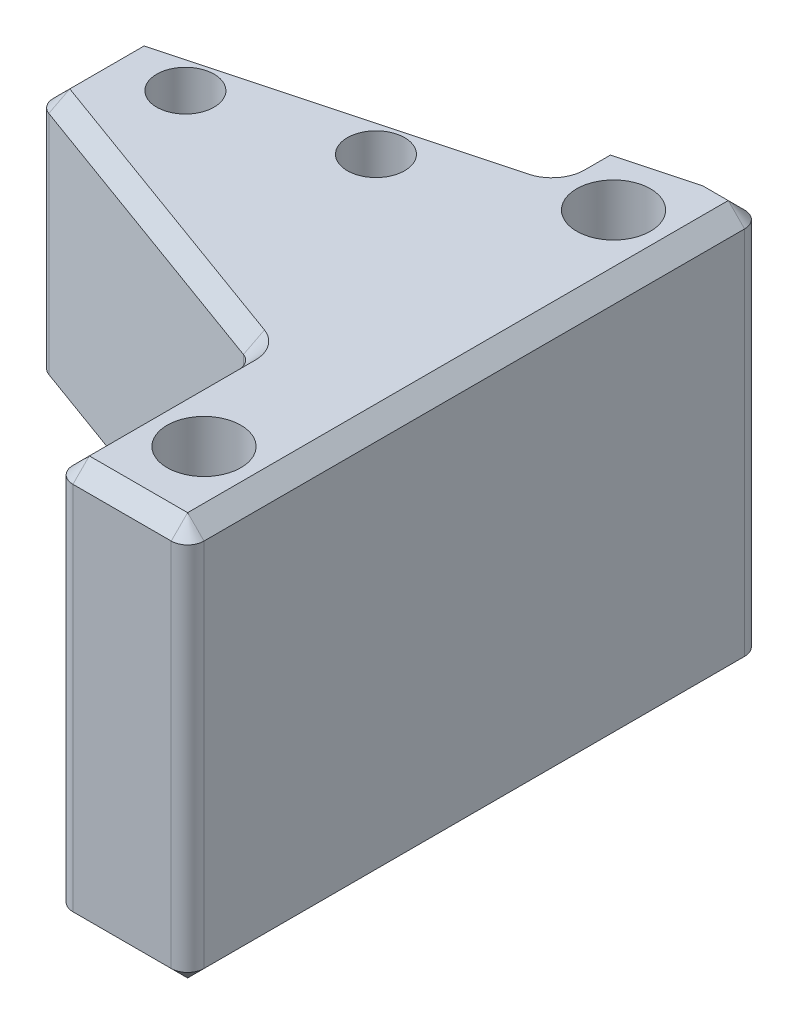
from build123d import *
from build123d.topology import SkipClean

# Parameters (mm, degrees)
SKETCH1_W              = 8
SKETCH1_H              = 35
SKETCH1_R              = 2.25
BOSS_EXTRUDE1_DEPTH    = 10
SKETCH2_R              = 1.75
BOSS_EXTRUDE2_DEPTH    = 10
CUT_EXTRUDE1_DEPTH     = 10
SKETCH3_R              = 2.25
BOSS_EXTRUDE3_DEPTH    = 6
BOSS_EXTRUDE5_START    = 9
SKETCH5_R              = 2.25
BOSS_EXTRUDE5_DEPTH    = 9
CUT_EXTRUDE2_START     = -8
CUT_EXTRUDE2_OUTLINE_W = 35
CUT_EXTRUDE2_OUTLINE_H = 0.2
CUT_EXTRUDE2_DEPTH     = 8
BOSS_EXTRUDE6_START    = 5.8
SKETCH8_R              = 1.75
BOSS_EXTRUDE6_DEPTH    = 5.8
SKETCH9_W              = 5.7
SKETCH9_H              = 2.8
CUT_EXTRUDE3_DEPTH     = 7
FILLET1_R              = 1
FILLET2_R              = 1
CHAMFER1_SIZE          = 1
CHAMFER2_SIZE          = 1


# Read off the part's stored shape, not the designer's step: Cut-Extrude2
# Some blends are built 0.0001 mm under size
with BuildPart() as part:
    # Sketch1 → Boss-Extrude1 (new body)
    with BuildSketch(Plane(origin=(0, 0, 0), x_dir=(1, 0, 0), z_dir=(0, 1, 0))):
        Rectangle(SKETCH1_W, SKETCH1_H)
        with Locations(Location((0, 12.5, 0), (0, 0, 270))):
            Circle(SKETCH1_R, mode=Mode.SUBTRACT)
        with Locations(Location((0, -12.5, 0), (0, 0, 270))):
            Circle(SKETCH1_R, mode=Mode.SUBTRACT)
    extrude(amount=BOSS_EXTRUDE1_DEPTH)

    # Sketch2 → Boss-Extrude2 (add, through all)
    with BuildSketch(Plane(origin=(0, 10, 0), x_dir=(1, 0, 0), z_dir=(0, 1, 0))):
        Polygon((-24, 1.60698438), (-4, -5.672420305), (-4, 12.965968228), (-24, 7.60698438), align=None)
        with Locations(Location((-19.37629535, 5.740073766, 0), (0, 0, 270))):
            Circle(SKETCH2_R, mode=Mode.SUBTRACT)
        with Locations(Location((-10.2, 8.198854694, 0), (0, 0, 270))):
            Circle(SKETCH2_R, mode=Mode.SUBTRACT)
    extrude(amount=-BOSS_EXTRUDE2_DEPTH)

    # Sketch2<3> → Cut-Extrude1 (cut)
    with BuildSketch(Plane(origin=(0, 10, 0), x_dir=(1, 0, 0), z_dir=(0, 1, 0))):
        Polygon((-4, 17.5), (-4, 16.07179677), (1.330127019, 17.5), align=None)
    extrude(amount=-CUT_EXTRUDE1_DEPTH, mode=Mode.SUBTRACT)

    # Sketch3 → Boss-Extrude3 (add)
    with BuildSketch(Plane(origin=(0, 10, 0), x_dir=(1, 0, 0), z_dir=(0, 1, 0))):
        Polygon((-4, 16.07179677), (-4, -17.5), (4, -17.5), (4, 17.5), (1.330127019, 17.5), align=None)
        with Locations(Location((0, -12.5, 0), (0, 0, 270))):
            Circle(SKETCH3_R, mode=Mode.SUBTRACT)
        with Locations(Location((0, 12.5, 0), (0, 0, 270))):
            Circle(SKETCH3_R, mode=Mode.SUBTRACT)
    extrude(amount=BOSS_EXTRUDE3_DEPTH)

    # Sketch5 → Boss-Extrude5 (add)
    with SkipClean():  # the faces are left unmerged after this step: merging them gives an invalid solid
        with BuildSketch(Plane.XZ.offset(BOSS_EXTRUDE5_START)):
            Polygon((-4, 17.5), (-4, -16.07179677), (1.330127019, -17.5), (4, -17.5), (4, 17.5), align=None)
            with Locations(Location((0, -12.5, 0), (0, 0, 270))):
                Circle(SKETCH5_R, mode=Mode.SUBTRACT)
            with Locations(Location((0, 12.5, 0), (0, 0, 270))):
                Circle(SKETCH5_R, mode=Mode.SUBTRACT)
        extrude(amount=-BOSS_EXTRUDE5_DEPTH)

    # Cut-Extrude2 outline → Cut-Extrude2 (cut)
    with SkipClean():  # the faces are left unmerged after this step: merging them gives an invalid solid
        with BuildSketch(Plane(origin=(4, 0, 0), x_dir=(0, 0, -1), z_dir=(1, 0, 0)).offset(CUT_EXTRUDE2_START)):
            with Locations((0, 15.9)):
                Rectangle(CUT_EXTRUDE2_OUTLINE_W, CUT_EXTRUDE2_OUTLINE_H)
            with Locations((0, -8.9)):
                Rectangle(CUT_EXTRUDE2_OUTLINE_W, CUT_EXTRUDE2_OUTLINE_H)
        extrude(amount=CUT_EXTRUDE2_DEPTH, mode=Mode.SUBTRACT)

    # Sketch8 → Boss-Extrude6 (add)
    with SkipClean():  # the faces are left unmerged after this step: merging them gives an invalid solid
        with BuildSketch(Plane(origin=(0, 10, 0), x_dir=(1, 0, 0), z_dir=(0, 1, 0)).offset(BOSS_EXTRUDE6_START)):
            Polygon((-4, -5.672420305), (-4, 12.965968228), (-24, 7.60698438), (-24, 1.60698438), align=None)
            with Locations(Location((-10.2, 8.198854694, 0), (0, 0, 270))):
                Circle(SKETCH8_R, mode=Mode.SUBTRACT)
            with Locations(Location((-19.37629535, 5.740073766, 0), (0, 0, 270))):
                Circle(SKETCH8_R, mode=Mode.SUBTRACT)
        extrude(amount=-BOSS_EXTRUDE6_DEPTH)

    # Sketch9 → Cut-Extrude3 (cut)
    with SkipClean():  # the faces are left unmerged after this step: merging them gives an invalid solid
        with BuildSketch(Plane(origin=(-3.50944125, 0, -13.09741305), x_dir=(-0.9659258262890672, 0, 0.25881904510252496), z_dir=(-0.25881904510252496, 0, -0.9659258262890672))):
            with Locations((7.730423685, 6.4)):
                Rectangle(SKETCH9_W, SKETCH9_H)
            with Locations((17.230423685, 6.4)):
                Rectangle(SKETCH9_W, SKETCH9_H)
        extrude(amount=-CUT_EXTRUDE3_DEPTH, mode=Mode.SUBTRACT)

    # Fillet1
    # the kernel refuses this fillet: 1 mm, written as the material it adds along each edge
    with BuildSketch(Plane(origin=(-4, 10, -12.965968228), x_dir=(0, 0, -1), z_dir=(0, -1, 0))) as fillet1_piece_1:
        with BuildLine():
            CenterArc((FILLET1_R * 0.767326987979, -FILLET1_R), FILLET1_R, 90, 75)
            Line((-FILLET1_R * 0.19859883831, -FILLET1_R * 0.741180954897), (0, 0))
            Line((0, 0), (FILLET1_R * 0.767326987979, 0))
        make_face()
    extrude(amount=10)
    with BuildSketch(Plane(origin=(-4, 10, 5.672420305), x_dir=(0, 0, 1), z_dir=(0, -1, 0))) as fillet1_piece_2:
        with BuildLine():
            CenterArc((FILLET1_R * 0.70020753821, FILLET1_R), FILLET1_R, 200, 70)
            Line((-FILLET1_R * 0.239485082576, FILLET1_R * 0.657979856674), (0, 0))
            Line((0, 0), (FILLET1_R * 0.70020753821, 0))
        make_face()
    extrude(amount=10)
    with BuildSketch(Plane(origin=(-4, 15.8, 5.672420305), x_dir=(0, 0, 1), z_dir=(0, -1, 0))) as fillet1_piece_3:
        with BuildLine():
            CenterArc((FILLET1_R * 0.70020753821, FILLET1_R), FILLET1_R, 200, 70)
            Line((-FILLET1_R * 0.239485082576, FILLET1_R * 0.657979856674), (0, 0))
            Line((0, 0), (FILLET1_R * 0.70020753821, 0))
        make_face()
    extrude(amount=5.8)
    with BuildSketch(Plane(origin=(-4, 15.8, -12.965968228), x_dir=(0, 0, -1), z_dir=(0, -1, 0))) as fillet1_piece_4:
        with BuildLine():
            CenterArc((FILLET1_R * 0.767326987979, -FILLET1_R), FILLET1_R, 90, 75)
            Line((-FILLET1_R * 0.19859883831, -FILLET1_R * 0.741180954897), (0, 0))
            Line((0, 0), (FILLET1_R * 0.767326987979, 0))
        make_face()
    extrude(amount=5.8)
    # the kernel refuses this fillet: 1 mm, written as the material it takes off along each edge
    with BuildSketch(Plane(origin=(4, 0, -17.5), x_dir=(0, 0, 1), z_dir=(0, 1, 0)), Plane(origin=(4, 0, 17.5), x_dir=(-1, 0, 0), z_dir=(0, 1, 0)), Plane(origin=(-4, 18.3, 17.5), x_dir=(1, 0, 0), z_dir=(0, -1, 0))) as fillet1_2_piece_1:
        with BuildLine():
            CenterArc((FILLET1_R, -FILLET1_R), FILLET1_R, 90, 90)
            Line((0, -FILLET1_R), (0, 0))
            Line((0, 0), (FILLET1_R, 0))
        make_face()
    extrude(amount=18.3, mode=Mode.SUBTRACT)
    with BuildSketch(Plane(origin=(-8.22356853, 5, -11.834266452), x_dir=(0.965925826289069, 0, -0.2588190451025184), z_dir=(0, 1, 0)), Plane(origin=(-13.72934574, 7.8, -10.358997895), x_dir=(-0.9659258262890653, 1.2688263138573222e-15, 0.2588190451025321), z_dir=(0, -1, 0)), Plane(origin=(-17.39986388, 5, -9.375485523), x_dir=(0.9659258262890693, 1.90323947078598e-15, -0.2588190451025172), z_dir=(0, 1, 0))) as fillet1_2_piece_2:
        with BuildLine():
            CenterArc((FILLET1_R, -FILLET1_R), FILLET1_R, 90, 90)
            Line((0, -FILLET1_R), (0, 0))
            Line((0, 0), (FILLET1_R, 0))
        make_face()
    extrude(amount=2.8, mode=Mode.SUBTRACT)
    with BuildSketch(Plane(origin=(-24, 10, -7.60698438), x_dir=(0.9659258262890668, 0, -0.2588190451025261), z_dir=(0, -1, 0))) as fillet1_2_piece_3:
        with BuildLine():
            CenterArc((FILLET1_R * 0.767326987979, FILLET1_R), FILLET1_R, 195, 75)
            Line((-FILLET1_R * 0.19859883831, FILLET1_R * 0.741180954897), (0, 0))
            Line((0, 0), (FILLET1_R * 0.767326987979, 0))
        make_face()
    extrude(amount=11.91831747, mode=Mode.SUBTRACT)
    with BuildSketch(Plane(origin=(-24, 10, -1.60698438), x_dir=(0.939692620785907, 0, 0.34202014332567215), z_dir=(0, -1, 0))) as fillet1_2_piece_4:
        with BuildLine():
            CenterArc((FILLET1_R * 0.70020753821, -FILLET1_R), FILLET1_R, 90, 70)
            Line((-FILLET1_R * 0.239485082576, -FILLET1_R * 0.657979856674), (0, 0))
            Line((0, 0), (FILLET1_R * 0.70020753821, 0))
        make_face()
    extrude(amount=11.750518846, mode=Mode.SUBTRACT)
    with BuildSketch(Plane(origin=(-4, 17.71831747, -16.07179677), x_dir=(0, 0, 1), z_dir=(0, -1, 0))) as fillet1_2_piece_5:
        with BuildLine():
            CenterArc((FILLET1_R * 0.767326987979, -FILLET1_R), FILLET1_R, 90, 75)
            Line((-FILLET1_R * 0.19859883831, -FILLET1_R * 0.741180954897), (0, 0))
            Line((0, 0), (FILLET1_R * 0.767326987979, 0))
        make_face()
    extrude(amount=17.71831747, mode=Mode.SUBTRACT)
    with BuildSketch(Plane(origin=(1.330127019, 0, -17.5), x_dir=(-0.9659258262890651, 0, 0.25881904510253334), z_dir=(0, 1, 0))) as fillet1_2_piece_6:
        with BuildLine():
            CenterArc((FILLET1_R * 0.131652497587, FILLET1_R), FILLET1_R, 255, 15)
            Line((-FILLET1_R * 0.127166547515, FILLET1_R * 0.0340741737109), (0, 0))
            Line((0, 0), (FILLET1_R * 0.131652497587, 0))
        make_face()
    extrude(amount=16.129131244, mode=Mode.SUBTRACT)
    with BuildSketch(Plane(origin=(1.330127019, -9.129131244, -17.5), x_dir=(-0.9659258262890651, 0, 0.25881904510253334), z_dir=(0, 1, 0))) as fillet1_2_piece_7:
        with BuildLine():
            CenterArc((FILLET1_R * 0.131652497587, FILLET1_R), FILLET1_R, 255, 15)
            Line((-FILLET1_R * 0.127166547515, FILLET1_R * 0.0340741737109), (0, 0))
            Line((0, 0), (FILLET1_R * 0.131652497587, 0))
        make_face()
    extrude(amount=9.129131244, mode=Mode.SUBTRACT)
    with BuildSketch(Plane(origin=(-4, -10.71831747, -16.07179677), x_dir=(0, 0, 1), z_dir=(0, 1, 0))) as fillet1_2_piece_8:
        with BuildLine():
            CenterArc((FILLET1_R * 0.767326987979, FILLET1_R), FILLET1_R, 195, 75)
            Line((-FILLET1_R * 0.19859883831, FILLET1_R * 0.741180954897), (0, 0))
            Line((0, 0), (FILLET1_R * 0.767326987979, 0))
        make_face()
    extrude(amount=10.71831747, mode=Mode.SUBTRACT)
    with BuildSketch(Plane(origin=(-24, 17.550518846, -1.60698438), x_dir=(0.939692620785907, 0, 0.34202014332567243), z_dir=(0, -1, 0))) as fillet1_2_piece_9:
        with BuildLine():
            CenterArc((FILLET1_R * 0.70020753821, -FILLET1_R), FILLET1_R, 90, 70)
            Line((-FILLET1_R * 0.239485082576, -FILLET1_R * 0.657979856674), (0, 0))
            Line((0, 0), (FILLET1_R * 0.70020753821, 0))
        make_face()
    extrude(amount=7.550518846, mode=Mode.SUBTRACT)
    with BuildSketch(Plane(origin=(-24, 17.71831747, -7.60698438), x_dir=(0.9659258262890671, 0, -0.2588190451025252), z_dir=(0, -1, 0))) as fillet1_2_piece_10:
        with BuildLine():
            CenterArc((FILLET1_R * 0.767326987979, FILLET1_R), FILLET1_R, 195, 75)
            Line((-FILLET1_R * 0.19859883831, FILLET1_R * 0.741180954897), (0, 0))
            Line((0, 0), (FILLET1_R * 0.767326987979, 0))
        make_face()
    extrude(amount=7.71831747, mode=Mode.SUBTRACT)
    with BuildSketch(Plane(origin=(-4, -11.3, 17.5), x_dir=(1, 0, 0), z_dir=(0, 1, 0))) as fillet1_2_piece_11:
        with BuildLine():
            CenterArc((FILLET1_R, FILLET1_R), FILLET1_R, 180, 90)
            Line((0, FILLET1_R), (0, 0))
            Line((0, 0), (FILLET1_R, 0))
        make_face()
    extrude(amount=11.3, mode=Mode.SUBTRACT)
    with BuildSketch(Plane(origin=(4, -11.3, 17.5), x_dir=(-1, 0, 0), z_dir=(0, 1, 0)), Plane(origin=(4, -11.3, -17.5), x_dir=(0, 0, 1), z_dir=(0, 1, 0))) as fillet1_2_piece_12:
        with BuildLine():
            CenterArc((FILLET1_R, -FILLET1_R), FILLET1_R, 90, 90)
            Line((0, -FILLET1_R), (0, 0))
            Line((0, 0), (FILLET1_R, 0))
        make_face()
    extrude(amount=11.3, mode=Mode.SUBTRACT)

    # Fillet2
    # the kernel refuses this fillet: 1 mm, written as the material it takes off along each edge
    with BuildSketch(Plane(origin=(-22.90564109, 7.8, -7.900216966), x_dir=(0.25881904510252646, 0, 0.9659258262890668), z_dir=(0, -1, 0))) as fillet2_piece_1:
        with BuildLine():
            CenterArc((FILLET2_R, FILLET2_R), FILLET2_R, 180, 90)
            Line((0, FILLET2_R), (0, 0))
            Line((0, 0), (FILLET2_R, 0))
        make_face()
    extrude(amount=2.8, mode=Mode.SUBTRACT)

    # Chamfer1
    chamfer1_edges = [part.edges().sort_by_distance(p)[0] for p in [
        (-14, 15.8, -10.286476304),
        (-4, 15.8, -14.518882499),
        (-24, 15.8, -4.573424655),
        (-14, 15.8, 2.032717963),
        (-4, 15.8, 11.436313922),
        (0, 15.8, 17.5),
        (4, 15.8, 0),
        (2.230889758, 15.8, -17.5),
        (-1.027929287, 15.8, -16.868160717),
        (-3.79335334, 15.8, -15.913231211),
        (1.331253324, 15.8, -17.491444861),
        (3.707106781, 15.8, -17.207106781),
        (3.707106781, 15.8, 17.207106781),
        (-3.707106781, 15.8, 17.207106781),
        (-23.819152044, 15.8, -1.733615482),
        (-23.79335334, 15.8, -7.448418821),
        (-4.180847956, 15.8, 5.799051407),
        (-4.20664666, 15.8, -13.124533787),
    ]]
    chamfer(chamfer1_edges, length=CHAMFER1_SIZE - 0.0001)  # a hair under: the kernel refuses the full size

    # Chamfer2
    chamfer2_edges = [part.edges().sort_by_distance(p)[0] for p in [
        (-4.20664666, 0, -13.124533787),
        (-23.819152044, 0, -1.733615482),
        (-24, 0, -4.573424655),
        (-23.79335334, 0, -7.448418821),
        (-14, 0, -10.286476304),
        (-4.180847956, 0, 5.799051407),
        (-14, 0, 2.032717963),
    ]]
    chamfer(chamfer2_edges, length=CHAMFER2_SIZE - 0.0001)  # a hair under: the kernel refuses the full size
    chamfer2_2_edges = [part.edges().sort_by_distance(p)[0] for p in [
        (-4, -8.8, 0.597765109),
        (-3.707106781, -8.8, 17.207106781),
        (-1.027929287, -8.8, -16.868160717),
        (-3.79335334, -8.8, -15.913231211),
        (0, -8.8, 17.5),
        (3.707106781, -8.8, 17.207106781),
        (4, -8.8, 0),
        (3.707106781, -8.8, -17.207106781),
        (2.230889758, -8.8, -17.5),
        (1.331253324, -8.8, -17.491444861),
    ]]
    chamfer(chamfer2_2_edges, length=CHAMFER2_SIZE - 0.0001)  # a hair under: the kernel refuses the full size


solid = part.part
